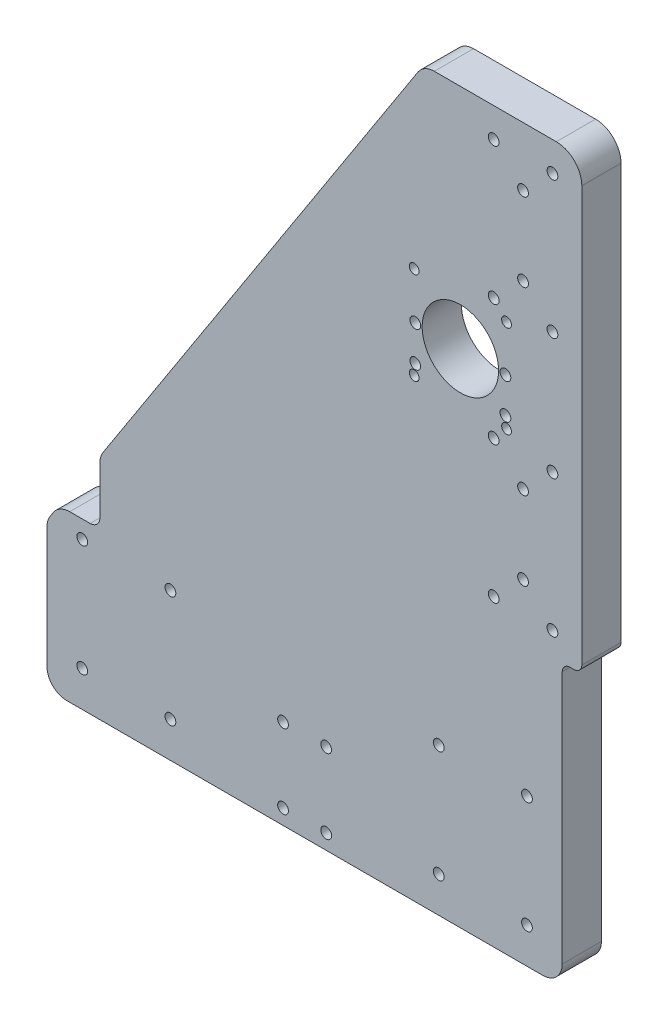
from build123d import *

# Parameters (mm, degrees)
SKETCH2_W               = 270.829085825
SKETCH2_H               = 362
BOSS_EXTRUDE1_DEPTH     = 20
SKETCH3_W               = 7.829085824
SKETCH3_H               = 395.153748613
CUT_EXTRUDE1_DEPTH      = 20
CUT_EXTRUDE2_DEPTH      = 20
FILLET1_R               = 10
M5_CLEARANCE_HOLE1_D    = 5.5
FILLET2_R               = 3
M5_CLEARANCE_HOLE2_D    = 5.5
M5_CLEARANCE_HOLE3_D    = 5.5
SKETCH11_R              = 19.5
CUT_EXTRUDE4_DEPTH      = 32.266788686
CUT_EXTRUDE5_DEPTH      = 20
FILLET3_R               = 10
FILLET4_R               = 5
TAP_DRILL_FOR_M6_TAP1_D = 5
BOSS_EXTRUDE2_DEPTH     = 20


with BuildPart() as part:
    # Sketch2 → Boss-Extrude1 (new body)
    with BuildSketch(Plane.XY.offset(94)):
        with Locations((2322.392578952, 638.909518743)):
            Rectangle(SKETCH2_W, SKETCH2_H)
    extrude(amount=BOSS_EXTRUDE1_DEPTH)

    # Sketch3 → Cut-Extrude1 (cut)
    with BuildSketch(Plane.XY.offset(114)):
        with Locations((2190.892578951, 642.586085608)):
            Rectangle(SKETCH3_W, SKETCH3_H)
    extrude(amount=-CUT_EXTRUDE1_DEPTH, mode=Mode.SUBTRACT)

    # Sketch4 → Cut-Extrude2 (cut)
    with BuildSketch(Plane.XY.offset(114)):
        Polygon((2194.807121863, 532.656963015), (2380.609228318, 819.909518743), (2194.807121863, 819.909518743), align=None)
    extrude(amount=-CUT_EXTRUDE2_DEPTH, mode=Mode.SUBTRACT)

    # Fillet1
    fillet1_edges = [part.edges().sort_by_distance(p)[0] for p in [
        (2457.807121864, 457.909518743, 104),
        (2194.807121863, 457.909518743, 104),
        (2194.807121863, 532.656963015, 104),
        (2380.609228318, 819.909518743, 104),
    ]]
    fillet(fillet1_edges, radius=FILLET1_R)

    # M5 Clearance Hole1 (through all)
    with Locations(Plane.XY.offset(114)):
        with Locations((2212.807121864, 533.160659234), (2257.807121864, 533.160659234), (2257.807121864, 476.160659234), (2212.807121864, 476.160659234), (2439.807121864, 476.160659234), (2394.807121864, 476.160659234), (2394.807121864, 533.160659234), (2439.807121864, 533.160659234), (2315.307121864, 503.660659234), (2337.307121864, 503.660659234), (2315.307121864, 465.660659234), (2337.307121864, 465.660659234)):
            Hole(M5_CLEARANCE_HOLE1_D / 2)

    # Fillet2
    fillet2_edges = [part.edges().sort_by_distance(p)[0] for p in [
        (2457.807121864, 819.909518743, 104),
    ]]
    fillet(fillet2_edges, radius=FILLET2_R)

    # M5 Clearance Hole2 (through all)
    with Locations(Plane.XY.offset(114)):
        with Locations((2422.807121864, 612.909518743), (2437.807121864, 627.909518743), (2452.807121864, 612.909518743), (2452.807121864, 682.909518743), (2437.807121864, 667.909518743), (2422.807121864, 682.909518743), (2452.807121864, 744.909518743), (2422.807121864, 814.909518743), (2452.807121864, 814.909518743), (2422.807121864, 744.909518743), (2437.807121864, 759.909518743), (2437.807121864, 799.909518743)):
            Hole(M5_CLEARANCE_HOLE2_D / 2)

    # M5 Clearance Hole3 (through all)
    with Locations(Plane(origin=(0, 0, 94), x_dir=(-1, 0, 0), z_dir=(0, 0, -1))):
        with Locations((-2428.807121866, 713.909518744), (-2428.807121866, 695.909518744), (-2382.807121866, 695.909518744), (-2382.807121866, 713.909518744)):
            Hole(M5_CLEARANCE_HOLE3_D / 2)

    # Sketch11 → Cut-Extrude4 (cut)
    with BuildSketch(Plane.XY.offset(114)):
        with Locations((2405.807121866, 713.909518744)):
            Circle(SKETCH11_R)
    extrude(amount=-CUT_EXTRUDE4_DEPTH, mode=Mode.SUBTRACT)

    # Sketch12 → Cut-Extrude5 (cut)
    with BuildSketch(Plane.XY.offset(114)):
        Polygon((2221.807121863, 542.160659234), (2195.807121863, 542.160659234), (2221.807121863, 575.660659234), align=None)
    extrude(amount=-CUT_EXTRUDE5_DEPTH, mode=Mode.SUBTRACT)

    # Fillet3
    fillet3_edges = [part.edges().sort_by_distance(p)[0] for p in [
        (2221.807121863, 574.399326181, 104),
        (2200.954349247, 542.160659234, 104),
    ]]
    fillet(fillet3_edges, radius=FILLET3_R)

    # Fillet4
    fillet4_edges = [part.edges().sort_by_distance(p)[0] for p in [
        (2221.807121863, 542.160659234, 104),
    ]]
    fillet(fillet4_edges, radius=FILLET4_R)

    # Tap Drill for M6 Tap1 (through all)
    with Locations(Plane(origin=(0, 0, 94), x_dir=(-1, 0, 0), z_dir=(0, 0, -1))):
        with Locations((-2429.377121866, 737.479518745), (-2382.237121866, 737.479518745), (-2429.377121866, 690.339518745), (-2382.237121866, 690.339518745)):
            Hole(TAP_DRILL_FOR_M6_TAP1_D / 2)

    # Sketch15 → Boss-Extrude2 (add)
    with BuildSketch(Plane.XY.offset(114)):
        with BuildLine():
            Line((2457.807121864, 816.909518743), (2457.807121864, 597.10478226))
            ThreePointArc((2457.807121864, 597.10478226), (2458.978694739, 599.933209385), (2461.807121864, 601.10478226))
            Line((2461.807121864, 601.10478226), (2463.807121864, 601.10478226))
            ThreePointArc((2463.807121864, 601.10478226), (2466.635548988, 602.276355135), (2467.807121864, 605.10478226))
            Line((2467.807121864, 605.10478226), (2467.807121864, 816.909518743))
            ThreePointArc((2467.807121864, 816.909518743), (2463.999510019, 826.101906899), (2454.807121864, 829.909518743))
            Line((2454.807121864, 829.909518743), (2392.518814604, 829.909518743))
            ThreePointArc((2392.518814604, 829.909518743), (2387.739237337, 828.693347131), (2384.122217308, 825.340646974))
            Line((2384.122217308, 825.340646974), (2377.653968279, 815.340646974))
            ThreePointArc((2377.653968279, 815.340646974), (2381.270988308, 818.693347131), (2386.050565575, 819.909518743))
            Line((2386.050565575, 819.909518743), (2454.807121864, 819.909518743))
            ThreePointArc((2454.807121864, 819.909518743), (2456.928442207, 819.030839087), (2457.807121864, 816.909518743))
        make_face()
    extrude(amount=-BOSS_EXTRUDE2_DEPTH)


solid = part.part
